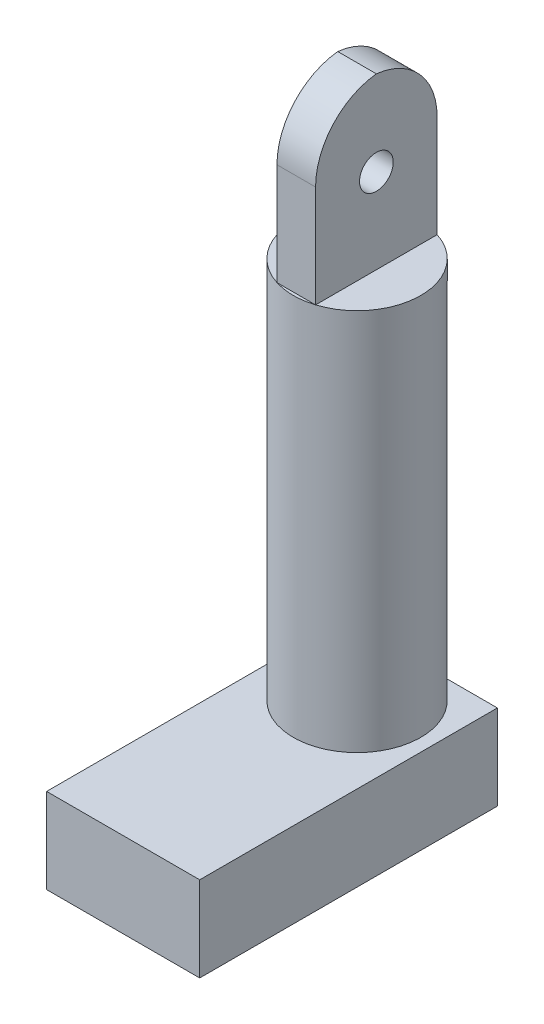
from build123d import *

# Parameters (mm, degrees)
SKETCH1_W               = 180
SKETCH1_H               = 350
BOSS_EXTRUDE1_DEPTH     = 100
SKETCH2_R               = 75
BOSS_EXTRUDE2_DEPTH     = 450
SKETCH3_W               = 45.419423784
SKETCH3_H               = 142.958301414
BOSS_EXTRUDE3_DEPTH     = 200
FILLET1_R               = 80
CUT_EXTRUDE1_DEPTH      = 778.911353606
CUT_EXTRUDE1_DEPTH_BACK = 778.911353606
SKETCH4_R               = 19.812422485


with BuildPart() as part:
    # Sketch1 → Boss-Extrude1 (new body)
    with BuildSketch(Plane(origin=(0, 0, 0), x_dir=(1, 0, 0), z_dir=(0, 1, 0))):
        Rectangle(SKETCH1_W, SKETCH1_H)
    extrude(amount=BOSS_EXTRUDE1_DEPTH)

    # Sketch2 → Boss-Extrude2 (add)
    with BuildSketch(Plane(origin=(0, 100, 0), x_dir=(1, 0, 0), z_dir=(0, 1, 0))):
        with Locations(Location((0, 100, 0), (0, 0, 90))):
            Circle(SKETCH2_R)
    extrude(amount=BOSS_EXTRUDE2_DEPTH)

    # Sketch3 → Boss-Extrude3 (add)
    with BuildSketch(Plane(origin=(0, 550, 0), x_dir=(1, 0, 0), z_dir=(0, 1, 0))):
        with Locations((0, 100)):
            Rectangle(SKETCH3_W, SKETCH3_H)
    extrude(amount=BOSS_EXTRUDE3_DEPTH)

    # Fillet1
    # the kernel refuses this fillet: 80 mm, written as the material it takes off along each edge
    with BuildSketch(Plane(origin=(222.709711892, 750, -171.479150707), x_dir=(0, -1, 0), z_dir=(-1, 0, 0)), Plane(origin=(-222.709711892, 750, -28.520849293), x_dir=(0, -1, 0), z_dir=(1, 0, 0))) as fillet1_piece_1:
        with BuildLine():
            CenterArc((FILLET1_R, FILLET1_R), FILLET1_R, 180, 90)
            Line((0, FILLET1_R), (0, 0))
            Line((0, 0), (FILLET1_R, 0))
        make_face()
    extrude(amount=445.419423783, mode=Mode.SUBTRACT)

    # Sketch4 → Cut-Extrude1 (cut, two sides: drawn at the far end of the back side and taken through both)
    with BuildSketch(Plane(origin=(-22.709711892, 0, 0), x_dir=(0, 0, -1), z_dir=(1, 0, 0)).offset(-CUT_EXTRUDE1_DEPTH_BACK)):
        with Locations((100, 649.772462607)):
            Circle(SKETCH4_R)
    extrude(amount=CUT_EXTRUDE1_DEPTH + CUT_EXTRUDE1_DEPTH_BACK, mode=Mode.SUBTRACT)


solid = part.part
